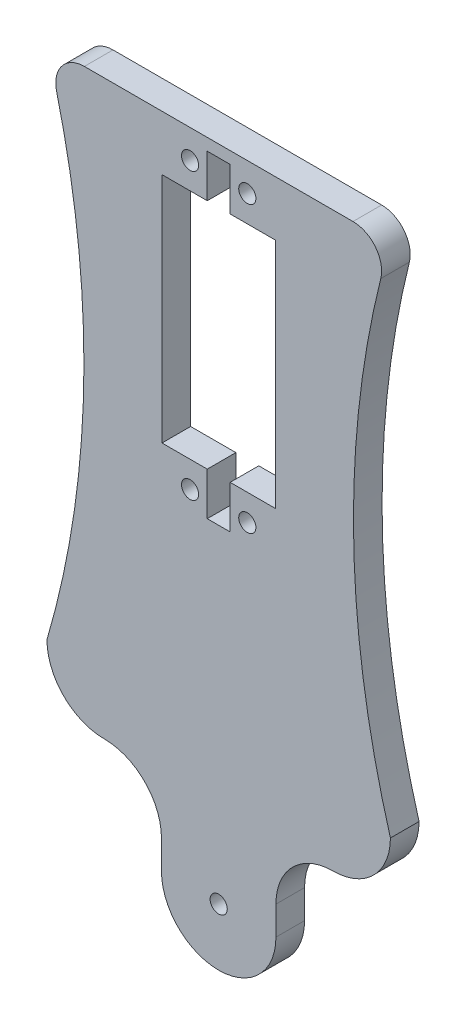
from build123d import *

# Parameters (mm, degrees)
RESSALTO_EXTRUS_O1_DEPTH = 5
ESBO_O2_R                = 1.5
CORTE_EXTRUS_O1_DEPTH    = 5
FILETE1_R                = 10
CORTE_EXTRUS_O2_DEPTH    = 5
ESBO_O4_R                = 1.5
CORTE_EXTRUS_O3_DEPTH    = 5
FILETE2_R                = 5
CORTE_EXTRUS_O4_DEPTH    = 5


with BuildPart() as part:
    # Esboço1 → Ressalto-extrusão1 (new body)
    with BuildSketch(Plane.XY):
        with BuildLine():
            Line((-14.089663978, 13.135393664), (-14.089663978, 28.135393664))
            Line((-14.089663978, 28.135393664), (-34.089663978, 28.135393664))
            Line((-34.089663978, 28.135393664), (-34.089663978, 128.135393664))
            Line((-34.089663978, 128.135393664), (25.910336022, 128.135393664))
            Line((25.910336022, 128.135393664), (25.910336022, 28.135393664))
            Line((25.910336022, 28.135393664), (5.910336022, 28.135393664))
            Line((5.910336022, 28.135393664), (5.910336022, 13.135393664))
            ThreePointArc((5.910336022, 13.135393664), (-4.089663978, 3.135393664), (-14.089663978, 13.135393664))
        make_face()
    extrude(amount=RESSALTO_EXTRUS_O1_DEPTH)

    # Esboço2 → Corte-extrusão1 (cut)
    with BuildSketch(Plane.XY.offset(5)):
        with Locations((-4.089663978, 13.135393664)):
            Circle(ESBO_O2_R)
    extrude(amount=-CORTE_EXTRUS_O1_DEPTH, mode=Mode.SUBTRACT)

    # Filete1
    filete1_edges = [part.edges().sort_by_distance(p)[0] for p in [
        (5.910336022, 28.135393664, 2.5),
        (-14.089663978, 28.135393664, 2.5),
    ]]
    fillet(filete1_edges, radius=FILETE1_R)
    filete1_2_edges = [part.edges().sort_by_distance(p)[0] for p in [
        (25.910336022, 28.135393664, 2.5),
        (-34.089663978, 28.135393664, 2.5),
    ]]
    fillet(filete1_2_edges, radius=FILETE1_R - 0.0001)  # a hair under: the kernel refuses the full size

    # Esboço3 → Corte-extrusão2 (cut)
    with BuildSketch(Plane.XY.offset(5)):
        with BuildLine():
            ThreePointArc((-34.089663978, 38.135393664), (-27.631189305, 83.135393664), (-34.089663978, 128.135393664))
            Line((-34.089663978, 128.135393664), (-34.089663978, 38.135393664))
        make_face()
        with BuildLine():
            ThreePointArc((25.910336022, 38.135393664), (19.45186135, 83.135393664), (25.910336022, 128.135393664))
            Line((25.910336022, 128.135393664), (25.910336022, 38.135393664))
        make_face()
    extrude(amount=-CORTE_EXTRUS_O2_DEPTH, mode=Mode.SUBTRACT)

    # Esboço4 → Corte-extrusão3 (cut)
    with BuildSketch(Plane.XY.offset(5)):
        with Locations((-9.089663978, 123.135393664)):
            Circle(ESBO_O4_R)
        with Locations((0.910336022, 123.135393664)):
            Circle(ESBO_O4_R)
        with Locations((-9.089663978, 73.355393664)):
            Circle(ESBO_O4_R)
        with Locations((0.910336022, 73.355393664)):
            Circle(ESBO_O4_R)
    extrude(amount=-CORTE_EXTRUS_O3_DEPTH, mode=Mode.SUBTRACT)

    # Filete2
    filete2_edges = [part.edges().sort_by_distance(p)[0] for p in [
        (-34.089663978, 128.135393664, 2.5),
        (25.910336022, 128.135393664, 2.5),
    ]]
    fillet(filete2_edges, radius=FILETE2_R)

    # Esboço5 → Corte-extrusão4 (cut)
    with BuildSketch(Plane.XY.offset(5)):
        Polygon((-13.989663978, 118.545393664), (-6.089663978, 118.545393664), (-6.089663978, 126.045393664), (-2.089663978, 126.045393664), (-2.089663978, 118.545393664), (5.810336022, 118.545393664), (5.810336022, 77.945393664), (-2.089663978, 77.945393664), (-2.089663978, 70.445393664), (-6.089663978, 70.445393664), (-6.089663978, 77.945393664), (-13.989663978, 77.945393664), align=None)
    extrude(amount=-CORTE_EXTRUS_O4_DEPTH, mode=Mode.SUBTRACT)


solid = part.part
